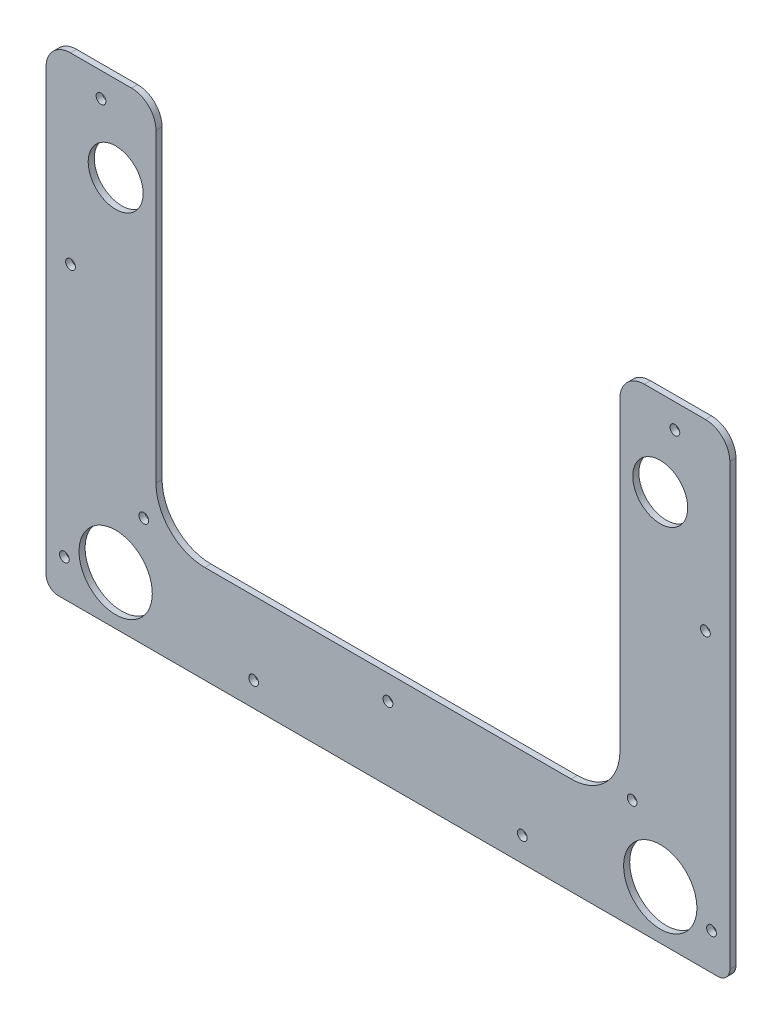
from build123d import *

# Parameters (mm, degrees)
SKETCH1_R           = 14.2875
SKETCH1_R_2         = 19.05
SKETCH1_R_3         = 2.54
BOSS_EXTRUDE3_DEPTH = 3.175


with BuildPart() as part:
    # Sketch1 → Boss-Extrude3 (new body)
    with BuildSketch(Plane.XY):
        with BuildLine():
            Line((120.65, -152.4), (120.65, -6.35))
            Line((120.65, -6.35), (120.65, 6.35))
            ThreePointArc((120.65, 6.35), (124.369743879, 15.330256121), (133.35, 19.05))
            Line((133.35, 19.05), (165.1, 19.05))
            ThreePointArc((165.1, 19.05), (174.080256121, 15.330256121), (177.8, 6.35))
            Line((177.8, 6.35), (177.8, -6.35))
            Line((177.8, -6.35), (177.8, -222.25))
            ThreePointArc((177.8, -222.25), (175.940128061, -226.740128061), (171.45, -228.6))
            Line((171.45, -228.6), (12.7, -228.6))
            Line((12.7, -228.6), (-12.7, -228.6))
            Line((-12.7, -228.6), (-171.45, -228.6))
            ThreePointArc((-171.45, -228.6), (-175.940128061, -226.740128061), (-177.8, -222.25))
            Line((-177.8, -222.25), (-177.8, -6.35))
            Line((-177.8, -6.35), (-177.8, 6.35))
            ThreePointArc((-177.8, 6.35), (-174.080256121, 15.330256121), (-165.1, 19.05))
            Line((-165.1, 19.05), (-133.35, 19.05))
            ThreePointArc((-133.35, 19.05), (-124.369743879, 15.330256121), (-120.65, 6.35))
            Line((-120.65, 6.35), (-120.65, -6.35))
            Line((-120.65, -6.35), (-120.65, -152.4))
            ThreePointArc((-120.65, -152.4), (-113.210512242, -170.360512242), (-95.25, -177.8))
            Line((-95.25, -177.8), (-12.7, -177.8))
            Line((-12.7, -177.8), (12.7, -177.8))
            Line((12.7, -177.8), (95.25, -177.8))
            ThreePointArc((95.25, -177.8), (113.210512242, -170.360512242), (120.65, -152.4))
        make_face()
        with Locations((141.605, -25.4)):
            Circle(SKETCH1_R, mode=Mode.SUBTRACT)
        with Locations((-141.605, -25.4)):
            Circle(SKETCH1_R, mode=Mode.SUBTRACT)
        with Locations((-141.605, -203.2)):
            Circle(SKETCH1_R_2, mode=Mode.SUBTRACT)
        with Locations((141.605, -203.2)):
            Circle(SKETCH1_R_2, mode=Mode.SUBTRACT)
        with Locations((-69.85, -215.9)):
            Circle(SKETCH1_R_3, mode=Mode.SUBTRACT)
        with Locations((69.85, -215.9)):
            Circle(SKETCH1_R_3, mode=Mode.SUBTRACT)
        with Locations((0, -190.5)):
            Circle(SKETCH1_R_3, mode=Mode.SUBTRACT)
        with Locations((-149.225, 6.35)):
            Circle(SKETCH1_R_3, mode=Mode.SUBTRACT)
        with Locations((149.225, 6.35)):
            Circle(SKETCH1_R_3, mode=Mode.SUBTRACT)
        with Locations((-168.275, -209.55)):
            Circle(SKETCH1_R_3, mode=Mode.SUBTRACT)
        with Locations((168.275, -209.55)):
            Circle(SKETCH1_R_3, mode=Mode.SUBTRACT)
        with Locations((-165.1, -76.2)):
            Circle(SKETCH1_R_3, mode=Mode.SUBTRACT)
        with Locations((165.1, -76.2)):
            Circle(SKETCH1_R_3, mode=Mode.SUBTRACT)
        with Locations((-127, -171.45)):
            Circle(SKETCH1_R_3, mode=Mode.SUBTRACT)
        with Locations((127, -171.45)):
            Circle(SKETCH1_R_3, mode=Mode.SUBTRACT)
    extrude(amount=BOSS_EXTRUDE3_DEPTH)


solid = part.part
